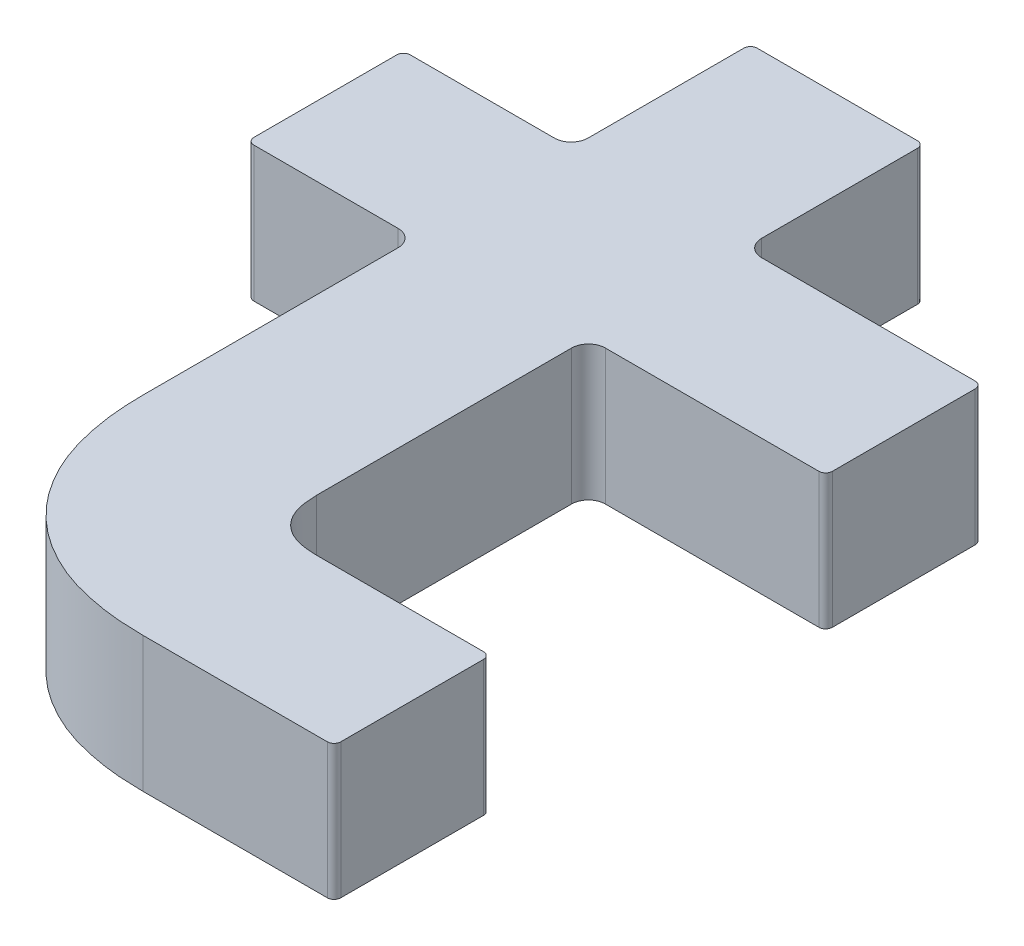
from build123d import *

# Parameters (mm, degrees)
BOSS_EXTRUDE1_DEPTH = 20
FILLET1_R           = 2.5
FILLET2_R           = 1


with BuildPart() as part:
    # Sketch1 → Boss-Extrude1 (new body)
    with BuildSketch(Plane(origin=(0, 0, 0), x_dir=(1, 0, 0), z_dir=(0, 1, 0))):
        with BuildLine():
            add(Edge.make_bspline(
                [(61.632976615, 0), (60.467406118, 0.020005887), (58.195165262, 0.059006698), (54.881527376, 0.472370772), (51.755321465, 1.107160034), (48.81102209, 1.992456231), (46.073507038, 3.163848037), (43.528288224, 4.588897448), (41.154606858, 6.248143716), (39.006338905, 8.189850597), (37.064632024, 10.338118551), (35.405385755, 12.711799916), (33.980336344, 15.25701873), (32.808944539, 17.994533783), (31.923648342, 20.938833158), (31.28885908, 24.065039068), (30.875495006, 27.378676955), (30.836494195, 29.65091781), (30.816488308, 30.816488308)],
                knots=[0, 0, 0, 0, 1.132521537, 2.207813008, 3.240526162, 4.2308148, 5.191009074, 6.128934944, 7.06207413, 8, 8.93792587, 9.871065056, 10.808990926, 11.7691852, 12.759473838, 13.792186992, 14.867478463, 16, 16, 16, 16], degree=3))
            Line((30.816488308, 30.816488308), (30.816488308, 71.046373365))
            Line((30.816488308, 71.046373365), (5.994847404, 71.046373365))
            Line((5.994847404, 71.046373365), (5.994847404, 94.183511692))
            Line((5.994847404, 94.183511692), (30.816488308, 94.183511692))
            Line((30.816488308, 94.183511692), (30.816488308, 120.714427269))
            Line((30.816488308, 120.714427269), (56.505152596, 120.714427269))
            Line((56.505152596, 120.714427269), (56.505152596, 94.183511692))
            Line((56.505152596, 94.183511692), (91.607213635, 94.183511692))
            Line((91.607213635, 94.183511692), (91.607213635, 71.046373365))
            Line((91.607213635, 71.046373365), (56.505152596, 71.046373365))
            Line((56.505152596, 71.046373365), (56.505152596, 30.816488308))
            add(Edge.make_bspline(
                [(56.505152596, 30.816488308), (56.528468898, 30.212104462), (56.572350165, 29.074654391), (56.908657565, 27.469978831), (57.525750448, 26.112844902), (58.399824619, 25.007038254), (59.505631267, 24.132964083), (60.862765197, 23.5158712), (62.467440756, 23.1795638), (63.604890827, 23.135682532), (64.209274673, 23.112366231)],
                knots=[0, 0, 0, 0, 1.161297374, 2.18556103, 3.129985484, 4, 4.870014516, 5.81443897, 6.838702626, 8, 8, 8, 8], degree=3))
            Line((64.209274673, 23.112366231), (89.897938962, 23.112366231))
            Line((89.897938962, 23.112366231), (89.897938962, 0))
            Line((89.897938962, 0), (61.632976615, 0))
        make_face()
    extrude(amount=-BOSS_EXTRUDE1_DEPTH)

    # Fillet1
    fillet1_edges = [part.edges().sort_by_distance(p)[0] for p in [
        (30.816488308, -10, -71.046373365),
        (30.816488308, -10, -94.183511692),
        (56.505152596, -10, -94.183511692),
        (56.505152596, -10, -71.046373365),
    ]]
    fillet(fillet1_edges, radius=FILLET1_R)

    # Fillet2
    fillet2_edges = [part.edges().sort_by_distance(p)[0] for p in [
        (89.897938962, -10, 0),
        (89.897938962, -10, -23.112366231),
        (5.994847404, -10, -71.046373365),
        (5.994847404, -10, -94.183511692),
        (30.816488308, -10, -120.714427269),
        (56.505152596, -10, -120.714427269),
        (91.607213635, -10, -94.183511692),
        (91.607213635, -10, -71.046373365),
    ]]
    fillet(fillet2_edges, radius=FILLET2_R)


solid = part.part
